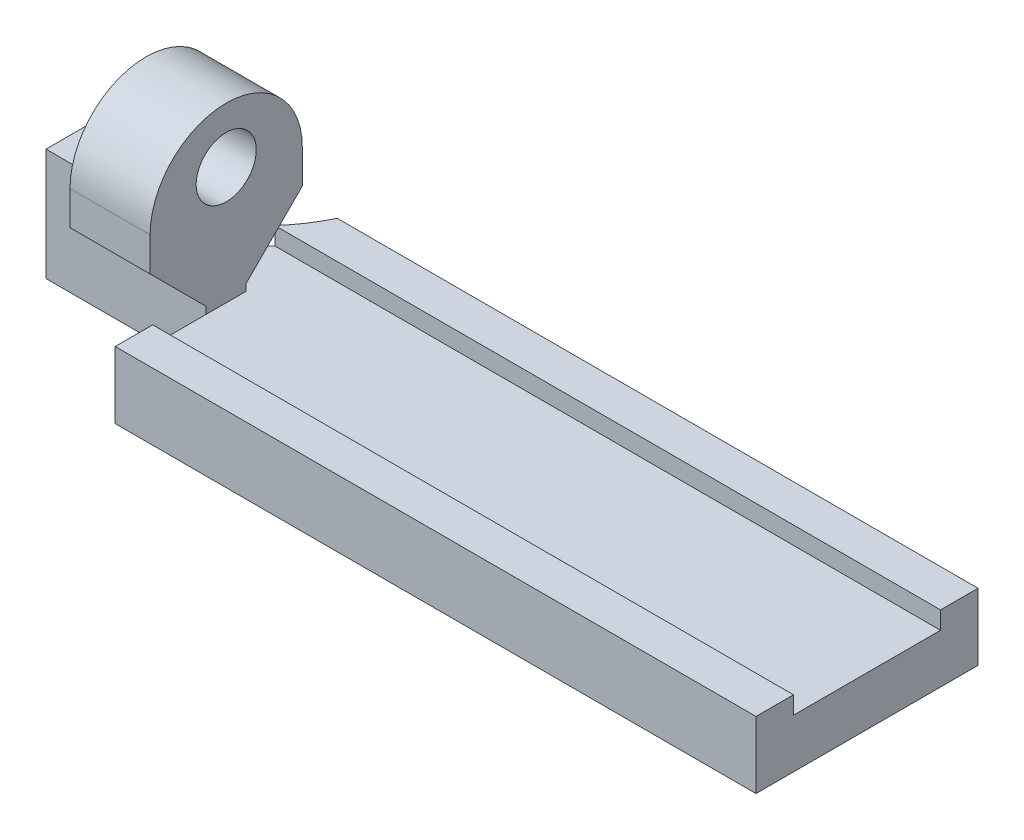
from build123d import *

# Parameters (mm, degrees)
SKETCH1_W           = 12.7
SKETCH1_H           = 8.89
BOSS_EXTRUDE1_DEPTH = 3.175
SKETCH2_R           = 2.38125
BOSS_EXTRUDE2_DEPTH = 6.35
CUT_EXTRUDE1_REACH  = 19.274
SKETCH4_R           = 1.190625
BOSS_EXTRUDE3_DEPTH = 50.8
FILLET1_R           = 12.7


with BuildPart() as part:
    # Sketch1 → Boss-Extrude1 (new body)
    with BuildSketch(Plane.XY):
        with Locations((-6.35, 4.445)):
            Rectangle(SKETCH1_W, SKETCH1_H)
    extrude(amount=BOSS_EXTRUDE1_DEPTH)

    # Sketch2 → Boss-Extrude2 (add)
    with BuildSketch(Plane(origin=(0, 0, 0), x_dir=(0, 0, -1), z_dir=(1, 0, 0))):
        with BuildLine():
            Line((-3.175, 4.445), (-7.62, 8.89))
            Line((-7.62, 8.89), (-7.62, 11.578578051))
            ThreePointArc((-7.62, 11.578578051), (-1.5875, 17.611078051), (4.445, 11.578578051))
            Line((4.445, 11.578578051), (4.445, 8.89))
            Line((4.445, 8.89), (0, 4.445))
            Line((0, 4.445), (0, 8.89))
            Line((0, 8.89), (-3.175, 8.89))
            Line((-3.175, 8.89), (-3.175, 4.445))
        make_face()
        with Locations((-1.5875, 13.208)):
            Circle(SKETCH2_R, mode=Mode.SUBTRACT)
    extrude(amount=-BOSS_EXTRUDE2_DEPTH)

    # Sketch4 → Cut-Extrude1 (cut, up to next)
    with BuildSketch(Plane(origin=(0, 8.89, 0), x_dir=(1, 0, 0), z_dir=(0, 1, 0)), mode=Mode.PRIVATE) as cut_extrude1_sk1:
        with Locations(Location((-7.62, -1.5875, 0), (0, 0, 270))):
            Circle(SKETCH4_R)
    cut_extrude1_tool1 = extrude(cut_extrude1_sk1.sketch, amount=-CUT_EXTRUDE1_REACH, mode=Mode.PRIVATE) & part.part
    add(cut_extrude1_tool1.solids().sort_by_distance((-7.62, 8.89, 1.5875))[0], mode=Mode.SUBTRACT)

    # Sketch5 → Boss-Extrude3 (add)
    with BuildSketch(Plane(origin=(0, 0, 0), x_dir=(0, 0, -1), z_dir=(1, 0, 0))):
        Polygon((-7.416824551, 5.296838174), (-10.387538025, 5.296838174), (-10.387538025, 0), (0, 0), (7.212538025, 0), (7.212538025, 5.296838174), (4.241824551, 5.296838174), (4.241824551, 3.895558234), (0, 3.895558234), (-3.175, 3.895558234), (-7.416824551, 3.895558234), align=None)
    extrude(amount=BOSS_EXTRUDE3_DEPTH)

    # Fillet1
    # the kernel refuses this fillet: 12.7 mm, written as the material it adds along each edge
    with BuildSketch(Plane(origin=(0, 32.528773329, 0), x_dir=(-1, 0, 0), z_dir=(0, -1, 0))) as fillet1_piece_1_section:
        with BuildLine():
            CenterArc((11.453286038, 12.7), FILLET1_R, 205.599864758, 64.400135242)
            Line((0, 7.212538025), (0, 0))
            Line((0, 0), (11.453286038, 0))
        make_face()
    fillet1_piece_1 = extrude(amount=32.528773329, mode=Mode.PRIVATE)
    fillet1_piece_1 = split(fillet1_piece_1, bisect_by=Plane(origin=(-0.789431936, 5.296838174, -5.756080296), z_dir=(0, -1, 0)), keep=Keep.TOP, mode=Mode.PRIVATE)
    fillet1_piece_1 = split(fillet1_piece_1, bisect_by=Plane(origin=(-0.789431936, 4.596198204, -4.241824551), z_dir=(0, 0, -1)), keep=Keep.TOP, mode=Mode.PRIVATE)
    add(fillet1_piece_1)
    with BuildSketch(Plane(origin=(0, 3.895558234, 0), x_dir=(-1, 0, 0), z_dir=(0, -1, 0))) as fillet1_piece_2:
        with BuildLine():
            CenterArc((11.453286038, 12.7), FILLET1_R, 205.599864758, 64.400135242)
            Line((0, 7.212538025), (0, 0))
            Line((0, 0), (11.453286038, 0))
        make_face()
    extrude(amount=3.895558234)


solid = part.part
